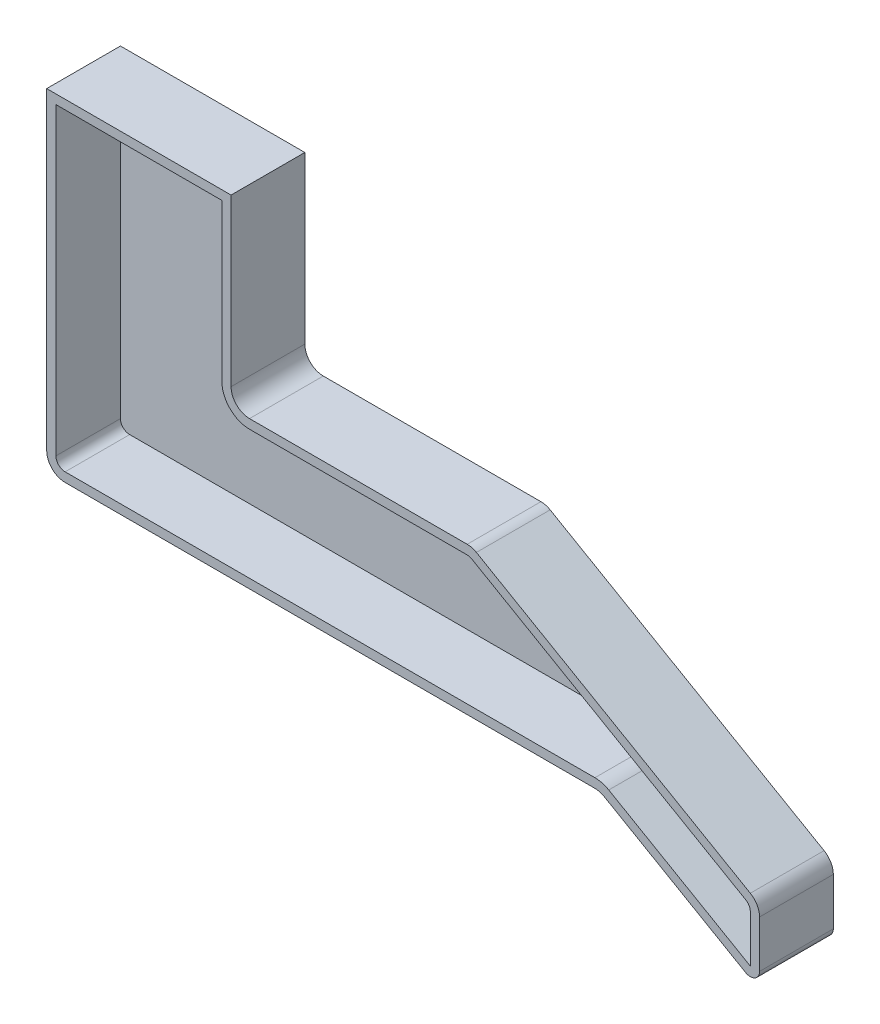
from build123d import *

# Parameters (mm, degrees)
EXTRUDE1_DEPTH = 20
SHELL1_START   = 2.5
SHELL1_DEPTH   = 17.5
SKETCH2_R      = 2.5
EXTRUDE2_DEPTH = 225.675435256


# Read off the part's stored shape, not the designer's step: Shell1
with BuildPart() as part:
    # Sketch1 → Extrude1 (new body)
    with BuildSketch(Plane.XY):
        with BuildLine():
            Line((0, 0), (0, -85))
            ThreePointArc((0, -85), (1.464466094, -88.535533906), (5, -90))
            Line((5, -90), (148.660254038, -90))
            ThreePointArc((148.660254038, -90), (149.954349263, -90.170370869), (151.160254038, -90.669872981))
            Line((151.160254038, -90.669872981), (189.551270189, -112.834936491))
            ThreePointArc((189.551270189, -112.834936491), (192.051270189, -112.834936491), (193.301270189, -110.669872981))
            Line((193.301270189, -110.669872981), (193.301270189, -97.886751346))
            ThreePointArc((193.301270189, -97.886751346), (192.631397208, -95.386751346), (190.801270189, -93.556624327))
            Line((190.801270189, -93.556624327), (116.519237886, -50.669872981))
            ThreePointArc((116.519237886, -50.669872981), (115.313333112, -50.170370869), (114.019237886, -50))
            Line((114.019237886, -50), (55, -50))
            ThreePointArc((55, -50), (51.464466094, -48.535533906), (50, -45))
            Line((50, -45), (50, 0))
            Line((50, 0), (0, 0))
        make_face()
    extrude(amount=EXTRUDE1_DEPTH)

    # Shell1 outline → Shell1 (cut)
    with BuildSketch(Plane.XY.offset(SHELL1_START)):
        with BuildLine():
            Line((2.5, -2.5), (2.5, -85))
            ThreePointArc((2.5, -85), (3.232233047, -86.767766953), (5, -87.5))
            Line((5, -87.5), (148.660254038, -87.5))
            ThreePointArc((148.660254038, -87.5), (150.601396876, -87.755556303), (152.410254038, -88.504809472))
            Line((152.410254038, -88.504809472), (190.801270189, -110.669872981))
            Line((190.801270189, -110.669872981), (190.801270189, -97.886751346))
            ThreePointArc((190.801270189, -97.886751346), (190.466333699, -96.636751346), (189.551270189, -95.721687836))
            Line((189.551270189, -95.721687836), (115.269237886, -52.834936491))
            ThreePointArc((115.269237886, -52.834936491), (114.666285499, -52.585185434), (114.019237886, -52.5))
            Line((114.019237886, -52.5), (55, -52.5))
            ThreePointArc((55, -52.5), (49.696699141, -50.303300859), (47.5, -45))
            Line((47.5, -45), (47.5, -2.5))
            Line((47.5, -2.5), (2.5, -2.5))
        make_face()
    extrude(amount=SHELL1_DEPTH, mode=Mode.SUBTRACT)

    # Sketch2 → Extrude2 (cut, through all)
    with BuildSketch(Plane.XY.offset(2.5)):
        with Locations((15, -10)):
            Circle(SKETCH2_R)
        with Locations((35, -10)):
            Circle(SKETCH2_R)
    extrude(amount=-EXTRUDE2_DEPTH, mode=Mode.SUBTRACT)


solid = part.part
